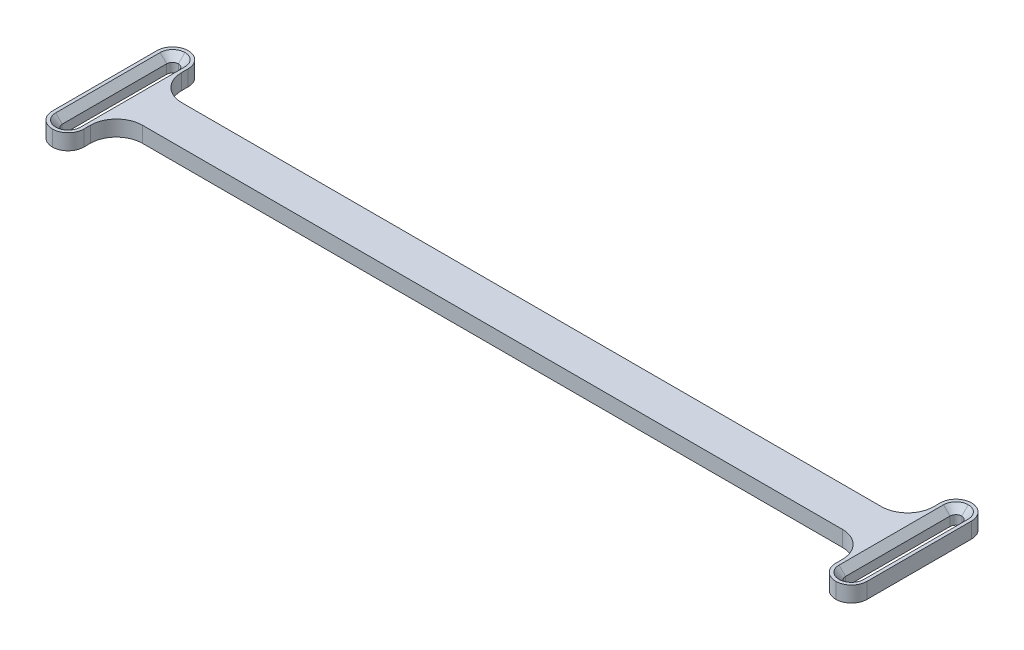
from build123d import *

# Parameters (mm, degrees)
BOSS_EXTRUDE1_DEPTH = 6
FILLET1_R           = 10
FILLET2_R           = 2.25
FILLET3_R           = 6
CHAMFER1_SIZE       = 2.5


with BuildPart() as part:
    # Sketch1 → Boss-Extrude1 (new body)
    with BuildSketch(Plane(origin=(0, 0, 0), x_dir=(1, 0, 0), z_dir=(0, 1, 0))):
        Polygon((-152.25, 0), (-156, 0), (-156, -26), (-144, -26), (-144, -7.5), (0, -7.5), (0, 0), (-85.684931507, 0), (-147.75, 0), (-147.75, -22.25), (-152.25, -22.25), align=None)
    extrude(amount=BOSS_EXTRUDE1_DEPTH)

    # Fillet1
    fillet1_edges = [part.edges().sort_by_distance(p)[0] for p in [
        (-144, 3, 7.5),
    ]]
    fillet(fillet1_edges, radius=FILLET1_R)

    # Fillet2
    fillet2_edges = [part.edges().sort_by_distance(p)[0] for p in [
        (-152.25, 3, 22.25),
        (-147.75, 3, 22.25),
    ]]
    fillet(fillet2_edges, radius=FILLET2_R - 0.0001)  # a hair under: the kernel refuses the full size

    # Fillet3
    fillet3_edges = [part.edges().sort_by_distance(p)[0] for p in [
        (-156, 3, 26),
        (-144, 3, 26),
    ]]
    fillet(fillet3_edges, radius=FILLET3_R - 0.0001)  # a hair under: the kernel refuses the full size

    # Chamfer1
    chamfer1_edges = [part.edges().sort_by_distance(p)[0] for p in [
        (-152.25, 6, 10.00005),
        (-147.75, 6, 10.00005),
        (-151.591019547, 6, 21.591019547),
        (-148.408980453, 6, 21.591019547),
    ]]
    chamfer(chamfer1_edges, length=CHAMFER1_SIZE)

    # Mirror1: part across plane


with BuildPart() as part_1:
    add(part.part)
    add(part.part.mirror(Plane(origin=(0, 6, 0), x_dir=(1, 0, 0), z_dir=(0, 0, 1))))

    # Mirror2: part across plane


with BuildPart() as part_2:
    add(part_1.part)
    add(part_1.part.mirror(Plane(origin=(0, 6, 0), x_dir=(0, 0, 1), z_dir=(1, 0, 0))))


solid = part_2.part
